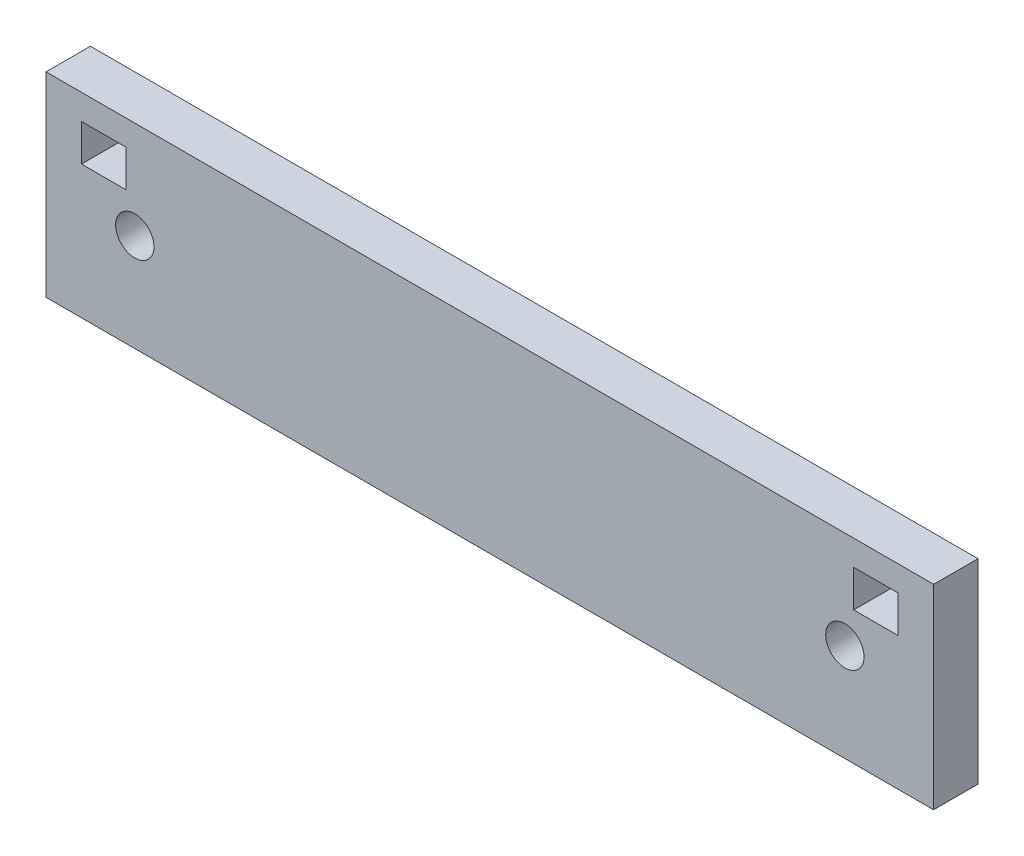
from build123d import *

# Parameters (mm, degrees)
SKETCH1_W           = 31.75
SKETCH1_H           = 6.985
SKETCH1_R           = 0.6858
SKETCH1_W_2         = 1.5875
SKETCH1_H_2         = 1.3208
BOSS_EXTRUDE1_DEPTH = 1.5875


with BuildPart() as part:
    # Sketch1 → Boss-Extrude1 (new body)
    with BuildSketch(Plane.XY):
        Rectangle(SKETCH1_W, SKETCH1_H)
        with Locations((-12.7, 0)):
            Circle(SKETCH1_R, mode=Mode.SUBTRACT)
        with Locations((12.7, 0)):
            Circle(SKETCH1_R, mode=Mode.SUBTRACT)
        with Locations((13.81125, 1.9304)):
            Rectangle(SKETCH1_W_2, SKETCH1_H_2, mode=Mode.SUBTRACT)
        with Locations((-13.81125, 1.9304)):
            Rectangle(SKETCH1_W_2, SKETCH1_H_2, mode=Mode.SUBTRACT)
    extrude(amount=BOSS_EXTRUDE1_DEPTH)


solid = part.part
